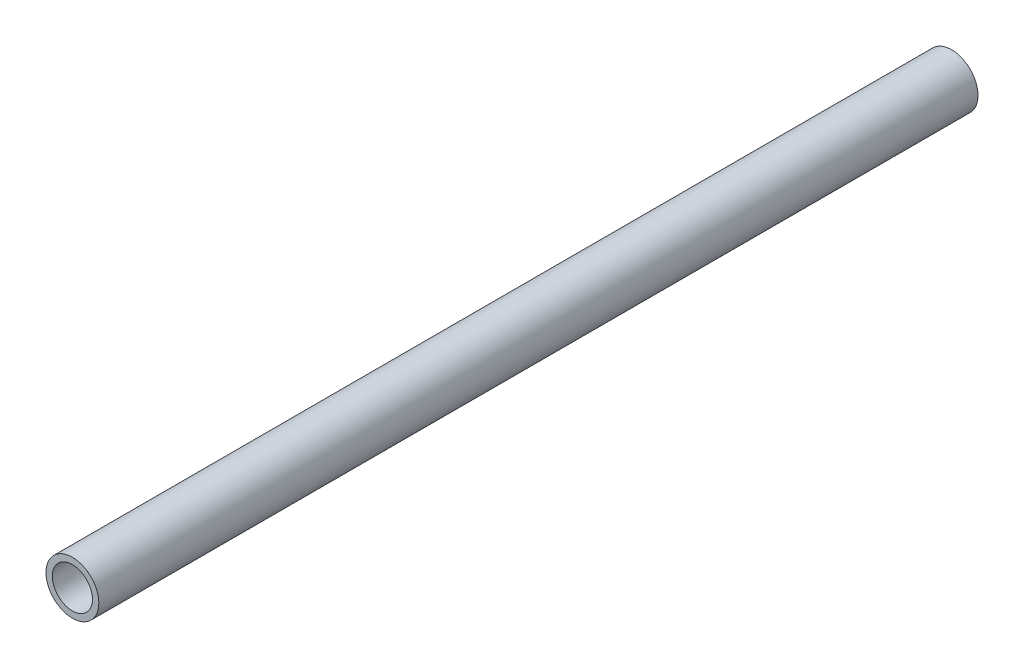
from build123d import *

# Parameters (mm, degrees)
ESQUISSE1_R        = 4.57
ESQUISSE1_R_2      = 3.47
BOSS_EXTRU_1_DEPTH = 152


with BuildPart() as part:
    # Esquisse1 → Boss.-Extru.1 (new body)
    with BuildSketch(Plane.XY):
        Circle(ESQUISSE1_R)
        Circle(ESQUISSE1_R_2, mode=Mode.SUBTRACT)
    extrude(amount=BOSS_EXTRU_1_DEPTH)


solid = part.part
